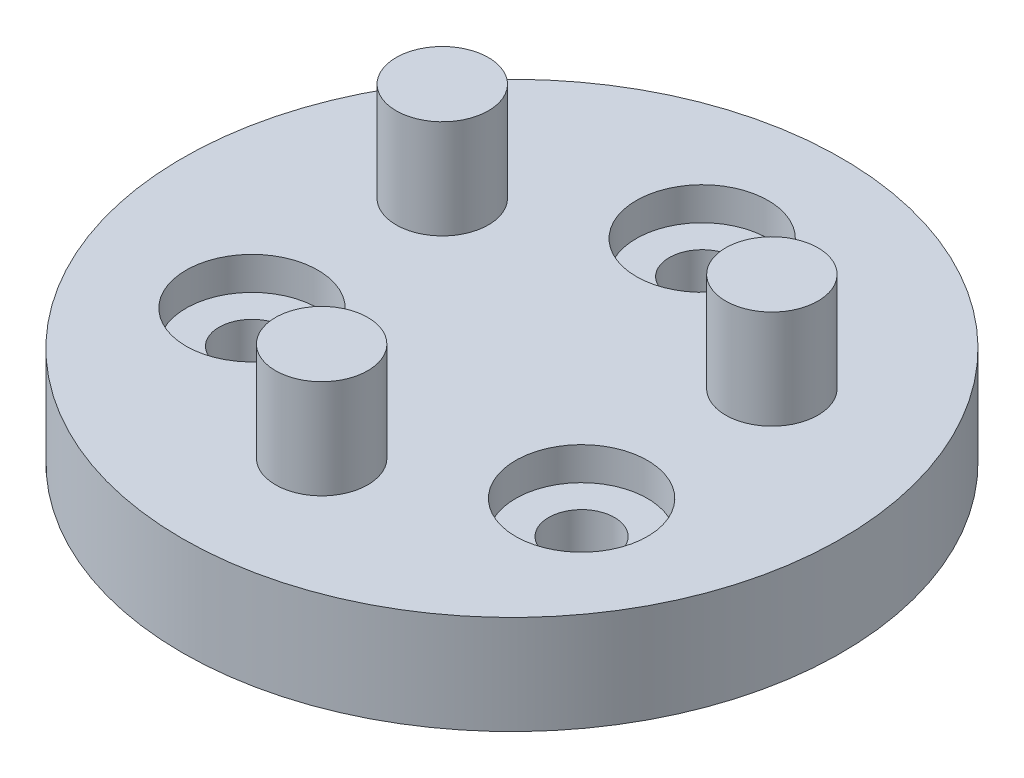
from build123d import *

# Parameters (mm, degrees)
SKETCH1_R           = 10
SKETCH1_R_2         = 1
BOSS_EXTRUDE1_DEPTH = 3
SKETCH2_R           = 2
CUT_EXTRUDE1_DEPTH  = 1
SKETCH4_R           = 1.4
BOSS_EXTRUDE2_DEPTH = 3


with BuildPart() as part:
    # Sketch1 → Boss-Extrude1 (new body)
    with BuildSketch(Plane(origin=(0, 0, 0), x_dir=(1, 0, 0), z_dir=(0, 1, 0))):
        Circle(SKETCH1_R)
        with Locations((0, 5.773502692)):
            Circle(SKETCH1_R_2, mode=Mode.SUBTRACT)
        with Locations((-5, -2.886751346)):
            Circle(SKETCH1_R_2, mode=Mode.SUBTRACT)
        with Locations((5, -2.886751346)):
            Circle(SKETCH1_R_2, mode=Mode.SUBTRACT)
    extrude(amount=BOSS_EXTRUDE1_DEPTH)

    # Sketch2 → Cut-Extrude1 (cut)
    with BuildSketch(Plane(origin=(0, 3, 0), x_dir=(1, 0, 0), z_dir=(0, 1, 0))):
        with Locations((0, 5.773502692)):
            Circle(SKETCH2_R)
        with Locations((-5, -2.886751346)):
            Circle(SKETCH2_R)
        with Locations((5, -2.886751346)):
            Circle(SKETCH2_R)
    extrude(amount=-CUT_EXTRUDE1_DEPTH, mode=Mode.SUBTRACT)

    # Sketch4 → Boss-Extrude2 (add)
    with BuildSketch(Plane(origin=(0, 3, 0), x_dir=(1, 0, 0), z_dir=(0, 1, 0))):
        with Locations((-5, 2.886751346)):
            Circle(SKETCH4_R)
        with Locations((5, 2.886751346)):
            Circle(SKETCH4_R)
        with Locations((0, -5.773502692)):
            Circle(SKETCH4_R)
    extrude(amount=BOSS_EXTRUDE2_DEPTH)


solid = part.part
